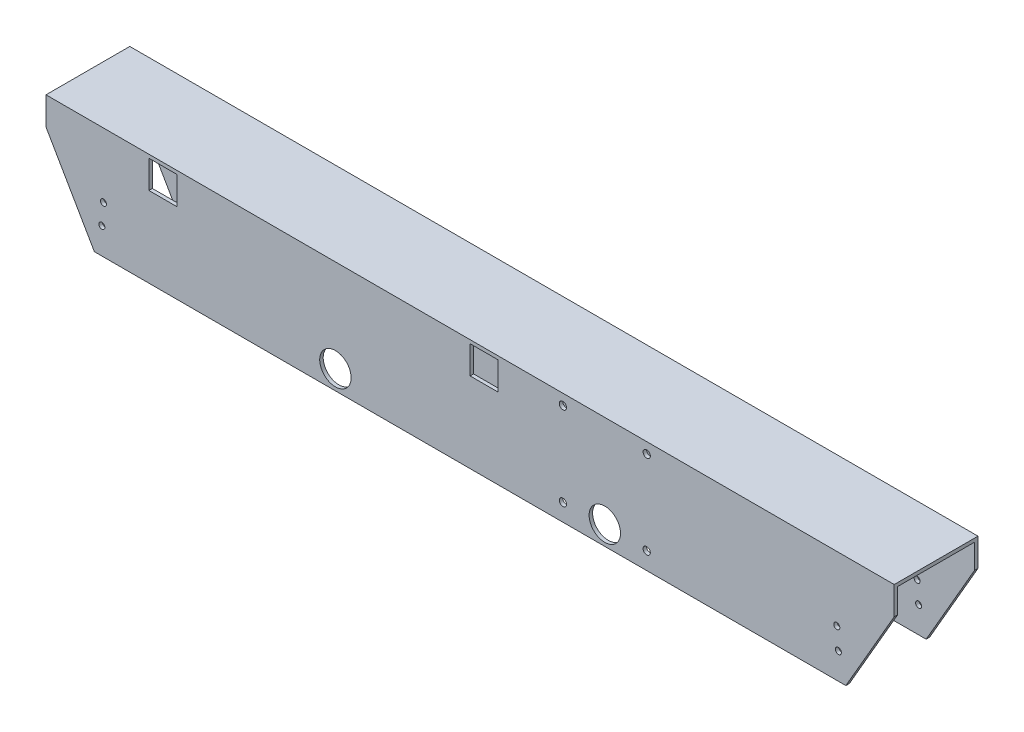
from build123d import *

# Parameters (mm, degrees)
BOSS_EXTRUDE1_DEPTH = 385.705756272
SKETCH2_R           = 2.749999961
SKETCH2_R_2         = 14.2875
SKETCH2_R_3         = 2.75
CUT_EXTRUDE1_DEPTH  = 141.732
SKETCH13_R          = 3.302
SKETCH13_W          = 25.4
SKETCH13_H          = 25.4
CUT_EXTRUDE11_DEPTH = 33.243623005
CUT_EXTRUDE13_DEPTH = 101.6


with BuildPart() as part:
    # Sketch1 → Boss-Extrude1 (new, symmetric)
    with BuildSketch(Plane(origin=(0, 0, 0), x_dir=(0, 0, -1), z_dir=(1, 0, 0))):
        Polygon((-38.1, 50.8), (38.1, 50.8), (38.1, -50.8), (34.925, -50.8), (34.925, 47.625), (-34.925, 47.625), (-34.925, -50.8), (-38.1, -50.8), align=None)
    extrude(amount=BOSS_EXTRUDE1_DEPTH, both=True)

    # Sketch2 → Cut-Extrude1 (cut)
    with BuildSketch(Plane.XY.offset(38.1)):
        with Locations((-333.475837626, -7.9375)):
            Circle(SKETCH2_R)
        with Locations((122.50039, -33.3375)):
            Circle(SKETCH2_R_2)
        with Locations((333.475837626, -7.9375)):
            Circle(SKETCH2_R)
        with Locations((334.902632555, -26.927596819)):
            Circle(SKETCH2_R_3)
        with Locations((-122.50039, -33.3375)):
            Circle(SKETCH2_R_2)
        with Locations((-334.902632555, -26.927596819)):
            Circle(SKETCH2_R_3)
    extrude(amount=-CUT_EXTRUDE1_DEPTH, mode=Mode.SUBTRACT)

    # Sketch13 → Cut-Extrude11 (cut)
    with BuildSketch(Plane(origin=(0, 0, 38.1), x_dir=(-1, 0, 0), z_dir=(0, 0, -1))):
        with Locations((-160.60039, -35.123476108)):
            Circle(SKETCH13_R)
        with Locations((-160.61182, 41.076523035)):
            Circle(SKETCH13_R)
        with Locations((-84.41182, 41.076523035)):
            Circle(SKETCH13_R)
        with Locations((-84.40039, -35.123476108)):
            Circle(SKETCH13_R)
        with Locations((-12.7, 34.925)):
            Rectangle(SKETCH13_W, SKETCH13_H)
        with Locations((279.4, 34.925)):
            Rectangle(SKETCH13_W, SKETCH13_H)
    extrude(amount=CUT_EXTRUDE11_DEPTH, mode=Mode.SUBTRACT)

    # Sketch16 → Cut-Extrude13 (cut)
    with BuildSketch(Plane.XY.offset(38.1)):
        Polygon((-385.705756272, 25.4), (-341.71166576, -50.8), (-385.705756272, -50.8), align=None)
        Polygon((341.71166576, -50.8), (385.705756272, -50.8), (385.705756272, 25.4), align=None)
    extrude(amount=-CUT_EXTRUDE13_DEPTH, mode=Mode.SUBTRACT)


solid = part.part
